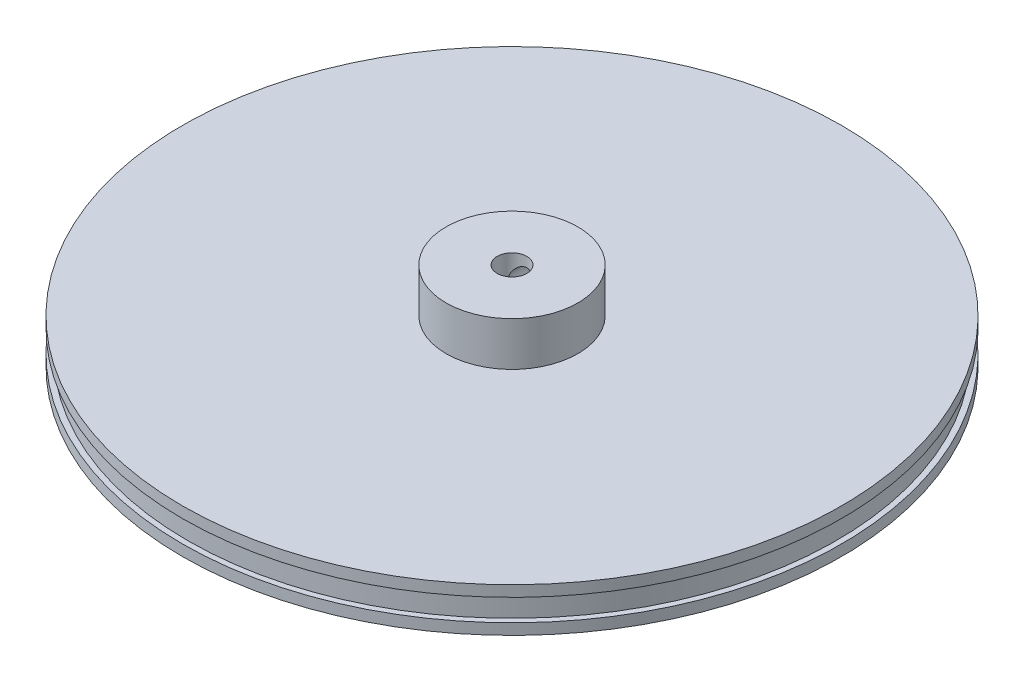
from build123d import *

# Parameters (mm, degrees)
SKETCH1_R           = 30
SKETCH1_R_2         = 1.35
BOSS_EXTRUDE1_DEPTH = 4
SKETCH1_3_R         = 6
SKETCH1_3_R_2       = 1.35
BOSS_EXTRUDE2_DEPTH = 8
SKETCH2_W           = 0.5
SKETCH2_H           = 2
SKETCH3_R           = 1.1
CUT_EXTRUDE1_DEPTH  = 10


with BuildPart() as part:
    # Sketch1 → Boss-Extrude1 (new body)
    with BuildSketch(Plane(origin=(0, 0, 0), x_dir=(1, 0, 0), z_dir=(0, 1, 0))):
        Circle(SKETCH1_R)
        Circle(SKETCH1_R_2, mode=Mode.SUBTRACT)
    extrude(amount=BOSS_EXTRUDE1_DEPTH)

    # Sketch1<3> → Boss-Extrude2 (add)
    with BuildSketch(Plane(origin=(0, 0, 0), x_dir=(1, 0, 0), z_dir=(0, 1, 0))):
        Circle(SKETCH1_3_R)
        Circle(SKETCH1_3_R_2, mode=Mode.SUBTRACT)
    extrude(amount=BOSS_EXTRUDE2_DEPTH)

    # Sketch2 → Cut-Revolve1 (revolve, cut)
    with BuildSketch(Plane.XY):
        with Locations((29.75, 2)):
            Rectangle(SKETCH2_W, SKETCH2_H)
    revolve(axis=Axis((0, 4, 0), (0, -1, 0)), mode=Mode.SUBTRACT)

    # Sketch3 → Cut-Extrude1 (cut)
    with BuildSketch(Plane.XY):
        with Locations((0, 6)):
            Circle(SKETCH3_R)
    extrude(amount=-CUT_EXTRUDE1_DEPTH, mode=Mode.SUBTRACT)


solid = part.part
